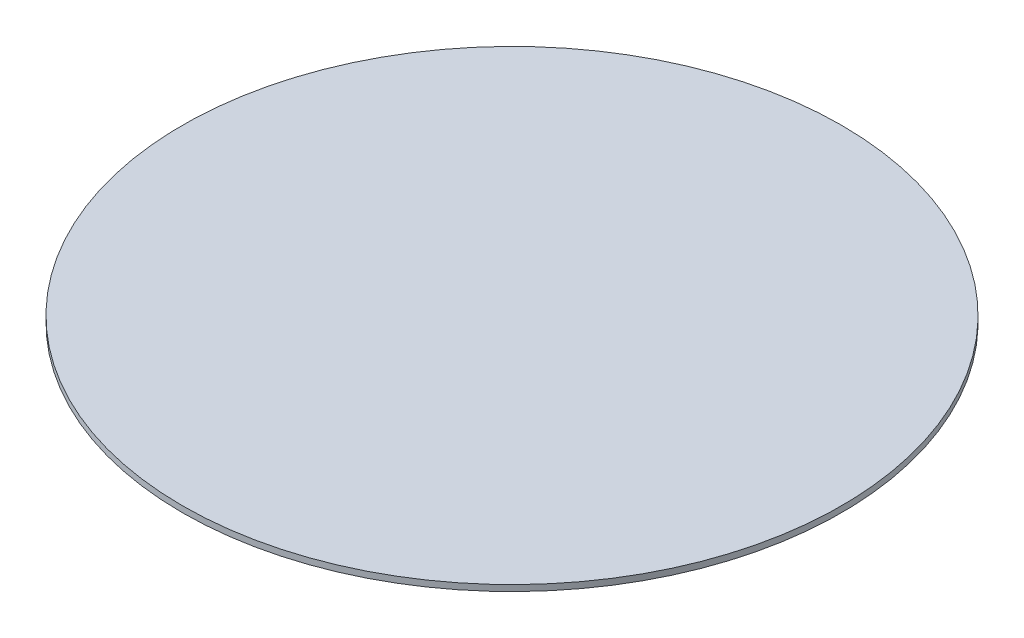
from build123d import *

# Parameters (mm, degrees)
SKETCH1_R          = 40
BASE_FLANGE1_DEPTH = 0.7366


# Sheet-metal steps are written as plain solids
with BuildPart() as part:
    # Sketch1 → Base-Flange1 (new body)
    with BuildSketch(Plane(origin=(0, 0, 0), x_dir=(1, 0, 0), z_dir=(0, 1, 0))):
        with Locations(Location((0, 0, 0), (0, 0, 270))):
            Circle(SKETCH1_R)
    extrude(amount=-BASE_FLANGE1_DEPTH)


solid = part.part
